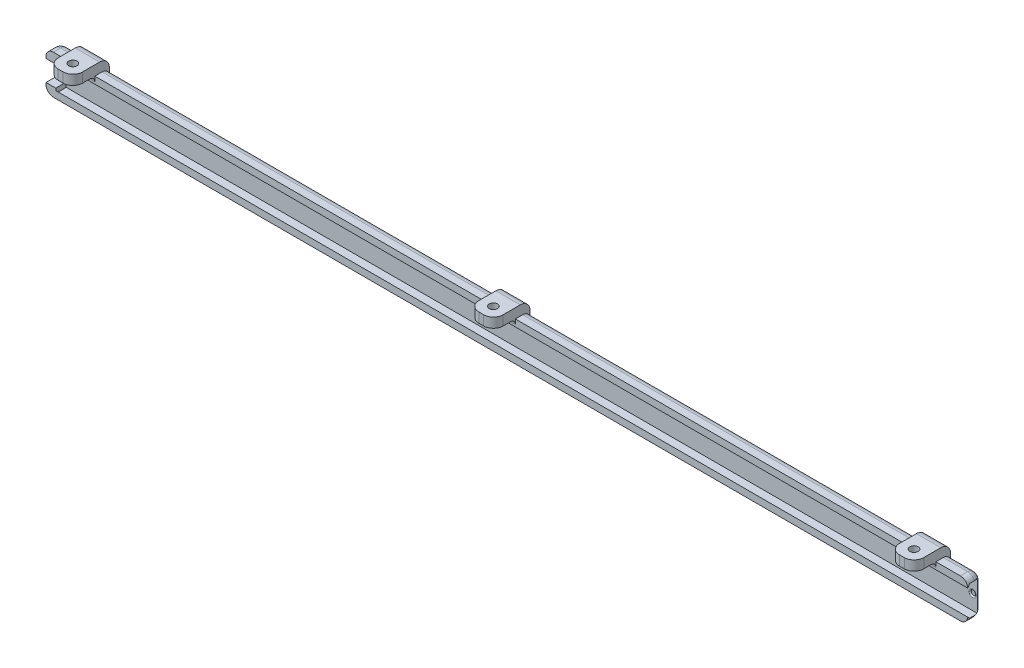
from build123d import *

# Parameters (mm, degrees)
SKETCH1_W               = 378
SKETCH1_H               = 16
BOSS_EXTRUDE1_DEPTH     = 6
CUT_EXTRUDE1_DEPTH      = 381.976768496
CUT_EXTRUDE1_DEPTH_BACK = 374
SKETCH3_W               = 4.3
SKETCH3_H               = 12.3
BOSS_EXTRUDE2_DEPTH     = 374
BOSS_EXTRUDE3_DEPTH     = 374
SKETCH6_W               = 4
SKETCH6_H               = 8.5
CUT_EXTRUDE2_DEPTH      = 378.00835287
FILLET2_R               = 3
SKETCH13_W              = 10
SKETCH13_H              = 15
BOSS_EXTRUDE5_DEPTH     = 4
FILLET9_R               = 3
FILLET10_R              = 4
SKETCH14_R              = 1.7
CUT_EXTRUDE5_DEPTH      = 4
FILLET11_R              = 4
FILLET12_R              = 4
LPATTERN3_COUNT         = 3
LPATTERN3_PITCH         = 172.5
LPATTERN4_COUNT         = 3
LPATTERN4_PITCH         = 172.5
FILLET13_R              = 4
FILLET14_R              = 4
FILLET15_R              = 3
FILLET16_R              = 4
FILLET17_R              = 4
FILLET18_R              = 4
FILLET19_R              = 4
FILLET20_R              = 2
FILLET21_R              = 2
FILLET22_R              = 2
FILLET23_R              = 3
SKETCH15_R              = 1
CUT_EXTRUDE6_DEPTH      = 0.5
FILLET24_R              = 0.5


# Some blends are built 0.0001 mm under size
with BuildPart() as part:
    # Sketch1 → Boss-Extrude1 (new body)
    with BuildSketch(Plane.XY):
        with Locations((31.46991404, 39.151862464)):
            Rectangle(SKETCH1_W, SKETCH1_H)
    extrude(amount=BOSS_EXTRUDE1_DEPTH)

    # Sketch3 → Cut-Extrude1 (cut, two sides: drawn at the far end of the back side and taken through both)
    with BuildSketch(Plane(origin=(220.46991404, 0, 0), x_dir=(0, 0, -1), z_dir=(1, 0, 0)).offset(-CUT_EXTRUDE1_DEPTH_BACK)):
        with Locations((-3.85, 39.151862464)):
            Rectangle(SKETCH3_W, SKETCH3_H)
    extrude(amount=CUT_EXTRUDE1_DEPTH + CUT_EXTRUDE1_DEPTH_BACK, mode=Mode.SUBTRACT)

    # Sketch4 → Boss-Extrude2 (add)
    with BuildSketch(Plane(origin=(220.46991404, 0, 0), x_dir=(0, 0, -1), z_dir=(1, 0, 0))):
        Polygon((-6, 33.001862464), (-6, 34.001862464), (-5, 33.001862464), align=None)
    extrude(amount=-BOSS_EXTRUDE2_DEPTH)

    # Sketch5 → Boss-Extrude3 (add)
    with BuildSketch(Plane(origin=(220.46991404, 0, 0), x_dir=(0, 0, -1), z_dir=(1, 0, 0))):
        Polygon((-6, 45.301862464), (-6, 44.301862464), (-5, 45.301862464), align=None)
    extrude(amount=-BOSS_EXTRUDE3_DEPTH)

    # Sketch6 → Cut-Extrude2 (cut, through all)
    with BuildSketch(Plane(origin=(-153.53008596, 0, 0), x_dir=(0, 0, -1), z_dir=(1, 0, 0))):
        with Locations((-4, 39.151862464)):
            Rectangle(SKETCH6_W, SKETCH6_H)
    extrude(amount=-CUT_EXTRUDE2_DEPTH, mode=Mode.SUBTRACT)

    # Fillet2
    # the kernel refuses this fillet: 3 mm, written as the material it takes off along each edge
    with BuildSketch(Plane(origin=(-157.53008596, 23.651862464, 0), x_dir=(0, 0, 1), z_dir=(0, 1, 0))) as fillet2_piece_1:
        with BuildLine():
            CenterArc((FILLET2_R, FILLET2_R), FILLET2_R, 180, 90)
            Line((0, FILLET2_R), (0, 0))
            Line((0, 0), (FILLET2_R, 0))
        make_face()
    extrude(amount=31, mode=Mode.SUBTRACT)

    # Sketch13 → Boss-Extrude5 (add)
    with BuildSketch(Plane(origin=(0, 47.151862464, 0), x_dir=(1, 0, 0), z_dir=(0, 1, 0))):
        with Locations((-142.53008596, -7.5)):
            Rectangle(SKETCH13_W, SKETCH13_H)
    boss_extrude5 = extrude(amount=BOSS_EXTRUDE5_DEPTH)

    # Fillet9
    fillet9_edges = [part.edges().sort_by_distance(p)[0] for p in [
        (32.96991404, 31.151862464, 0),
        (-156.651406303, 31.151862464, 0.878679656),
        (-157.53008596, 31.151862464, 4.5),
    ]]
    fillet(fillet9_edges, radius=FILLET9_R)

    # Fillet10
    fillet10_edges = [part.edges().sort_by_distance(p)[0] for p in [
        (-142.53008596, 51.151862464, 0),
    ]]
    fillet(fillet10_edges, radius=FILLET10_R)

    # Sketch14 → Cut-Extrude5 (cut)
    with BuildSketch(Plane.XZ.offset(-47.151862464)):
        with Locations(Location((-142.53008596, 10, 0), (0, 0, 270))):
            Circle(SKETCH14_R)
    cut_extrude5 = extrude(amount=-CUT_EXTRUDE5_DEPTH, mode=Mode.SUBTRACT)

    # Fillet11
    fillet11_edges = [part.edges().sort_by_distance(p)[0] for p in [
        (-137.53008596, 49.151862464, 15),
    ]]
    fillet(fillet11_edges, radius=FILLET11_R)

    # Fillet12
    fillet12_edges = [part.edges().sort_by_distance(p)[0] for p in [
        (-147.53008596, 49.151862464, 15),
    ]]
    fillet(fillet12_edges, radius=FILLET12_R)

    # LPattern3: Boss-Extrude5 ×3
    with Locations(*[(i * LPATTERN3_PITCH, 0, 0) for i in range(1, LPATTERN3_COUNT)]):
        add(boss_extrude5)

    # LPattern4: Cut-Extrude5 ×3
    with Locations(*[(i * LPATTERN4_PITCH, 0, 0) for i in range(1, LPATTERN4_COUNT)]):
        add(cut_extrude5, mode=Mode.SUBTRACT)

    # Fillet13
    fillet13_edges = [part.edges().sort_by_distance(p)[0] for p in [
        (29.96991404, 51.151862464, 0),
    ]]
    fillet(fillet13_edges, radius=FILLET13_R)

    # Fillet14
    fillet14_edges = [part.edges().sort_by_distance(p)[0] for p in [
        (202.46991404, 51.151862464, 0),
    ]]
    fillet(fillet14_edges, radius=FILLET14_R)

    # Fillet15
    # the kernel refuses this fillet: 3 mm, written as the material it takes off along each edge
    with BuildSketch(Plane(origin=(34.96991404, 47.151862464, 0), x_dir=(0, -1, 0), z_dir=(1, 0, 0)), Plane(origin=(-137.53008596, 47.151862464, 0), x_dir=(0, -1, 0), z_dir=(1, 0, 0))) as fillet15_piece_1:
        with BuildLine():
            CenterArc((FILLET15_R, -FILLET15_R), FILLET15_R, 90, 90)
            Line((0, -FILLET15_R), (0, 0))
            Line((0, 0), (FILLET15_R, 0))
        make_face()
    extrude(amount=162.5, mode=Mode.SUBTRACT)
    with BuildSketch(Plane(origin=(207.46991404, 47.151862464, 0), x_dir=(0, -1, 0), z_dir=(1, 0, 0))) as fillet15_piece_2:
        with BuildLine():
            CenterArc((FILLET15_R, -FILLET15_R), FILLET15_R, 90, 90)
            Line((0, -FILLET15_R), (0, 0))
            Line((0, 0), (FILLET15_R, 0))
        make_face()
    extrude(amount=20.5, mode=Mode.SUBTRACT)
    with BuildSketch(Plane(origin=(-157.53008596, 47.151862464, 3), x_dir=(1, 0, 0), z_dir=(0, 0, 1))) as fillet15_piece_3:
        with BuildLine():
            CenterArc((FILLET15_R, -FILLET15_R), FILLET15_R, 90, 90)
            Line((0, -FILLET15_R), (0, 0))
            Line((0, 0), (FILLET15_R, 0))
        make_face()
    extrude(amount=10.5, mode=Mode.SUBTRACT)
    with BuildSketch(Plane(origin=(-154.53008596, 47.151862464, 3), x_dir=(-1, 0, 0), z_dir=(0, 0, 1))) as fillet15_piece_4:
        with BuildLine():
            CenterArc((3 - FILLET15_R, FILLET15_R), FILLET15_R, 270, 90)
            Line((3 - FILLET15_R, 0), (3, 0))
            Line((3, 0), (3, FILLET15_R))
        make_face()
    revolve(axis=Axis((-154.53008596, 47.151862464, 3), (0, -1, 0)), revolution_arc=90, mode=Mode.SUBTRACT)
    with BuildSketch(Plane(origin=(-154.53008596, 47.151862464, 0), x_dir=(0, -1, 0), z_dir=(1, 0, 0))) as fillet15_piece_5:
        with BuildLine():
            CenterArc((FILLET15_R, -FILLET15_R), FILLET15_R, 90, 90)
            Line((0, -FILLET15_R), (0, 0))
            Line((0, 0), (FILLET15_R, 0))
        make_face()
    extrude(amount=7, mode=Mode.SUBTRACT)

    # Fillet16
    fillet16_edges = [part.edges().sort_by_distance(p)[0] for p in [
        (24.96991404, 49.151862464, 15),
    ]]
    fillet(fillet16_edges, radius=FILLET16_R)

    # Fillet17
    fillet17_edges = [part.edges().sort_by_distance(p)[0] for p in [
        (34.96991404, 49.151862464, 15),
    ]]
    fillet(fillet17_edges, radius=FILLET17_R)

    # Fillet18
    fillet18_edges = [part.edges().sort_by_distance(p)[0] for p in [
        (207.46991404, 49.151862464, 15),
    ]]
    fillet(fillet18_edges, radius=FILLET18_R)

    # Fillet19
    fillet19_edges = [part.edges().sort_by_distance(p)[0] for p in [
        (197.46991404, 49.151862464, 15),
    ]]
    fillet(fillet19_edges, radius=FILLET19_R)

    # Fillet20
    fillet20_edges = [part.edges().sort_by_distance(p)[0] for p in [
        (202.46991404, 47.151862464, 6),
    ]]
    fillet(fillet20_edges, radius=FILLET20_R)

    # Fillet21
    fillet21_edges = [part.edges().sort_by_distance(p)[0] for p in [
        (29.96991404, 47.151862464, 6),
    ]]
    fillet(fillet21_edges, radius=FILLET21_R)

    # Fillet22
    fillet22_edges = [part.edges().sort_by_distance(p)[0] for p in [
        (-142.53008596, 47.151862464, 6),
    ]]
    fillet(fillet22_edges, radius=FILLET22_R)

    # Fillet23
    # the kernel refuses this fillet: 3 mm, written as the material it takes off along each edge
    with BuildSketch(Plane(origin=(220.46991404, 31.151862464, 3), x_dir=(0, 1, 0), z_dir=(0, 0, 1))) as fillet23_piece_1:
        with BuildLine():
            CenterArc((FILLET23_R, FILLET23_R), FILLET23_R, 180, 90)
            Line((0, FILLET23_R), (0, 0))
            Line((0, 0), (FILLET23_R, 0))
        make_face()
    extrude(amount=10.5, mode=Mode.SUBTRACT)
    with BuildSketch(Plane(origin=(220.46991404, 34.151862464, 3), x_dir=(0, 0, -1), z_dir=(0, 1, 0))) as fillet23_piece_2:
        with BuildLine():
            CenterArc((3 - FILLET23_R, FILLET23_R), FILLET23_R, 270, 90)
            Line((3, FILLET23_R), (3, 0))
            Line((3, 0), (3 - FILLET23_R, 0))
        make_face()
    revolve(axis=Axis((220.46991404, 34.151862464, 3), (-1, 0, 0)), revolution_arc=90, mode=Mode.SUBTRACT)
    with BuildSketch(Plane(origin=(220.46991404, 47.151862464, 3), x_dir=(0, -1, 0), z_dir=(0, 0, 1))) as fillet23_piece_3:
        with BuildLine():
            CenterArc((FILLET23_R, -FILLET23_R), FILLET23_R, 90, 90)
            Line((0, -FILLET23_R), (0, 0))
            Line((0, 0), (FILLET23_R, 0))
        make_face()
    extrude(amount=10.5, mode=Mode.SUBTRACT)
    with BuildSketch(Plane(origin=(220.46991404, 44.151862464, 3), x_dir=(0, 1, 0), z_dir=(0, 0, 1))) as fillet23_piece_4:
        with BuildLine():
            CenterArc((3 - FILLET23_R, FILLET23_R), FILLET23_R, 270, 90)
            Line((3, FILLET23_R), (3, 0))
            Line((3, 0), (3 - FILLET23_R, 0))
        make_face()
    revolve(axis=Axis((220.46991404, 44.151862464, 3), (-1, 0, 0)), revolution_arc=90, mode=Mode.SUBTRACT)
    with BuildSketch(Plane(origin=(220.46991404, 44.151862464, 0), x_dir=(0, 0, 1), z_dir=(0, -1, 0))) as fillet23_piece_5:
        with BuildLine():
            CenterArc((FILLET23_R, FILLET23_R), FILLET23_R, 180, 90)
            Line((0, FILLET23_R), (0, 0))
            Line((0, 0), (FILLET23_R, 0))
        make_face()
    extrude(amount=10, mode=Mode.SUBTRACT)

    # Sketch15 → Cut-Extrude6 (cut)
    with BuildSketch(Plane.XY.offset(1.7)):
        with Locations((218.173615207, 39.151862464)):
            Circle(SKETCH15_R)
    extrude(amount=-CUT_EXTRUDE6_DEPTH, mode=Mode.SUBTRACT)

    # Fillet24
    fillet24_edges = [part.edges().sort_by_distance(p)[0] for p in [
        (217.173615207, 39.151862464, 1.7),
    ]]
    fillet(fillet24_edges, radius=FILLET24_R - 0.0001)  # a hair under: the kernel refuses the full size


solid = part.part
